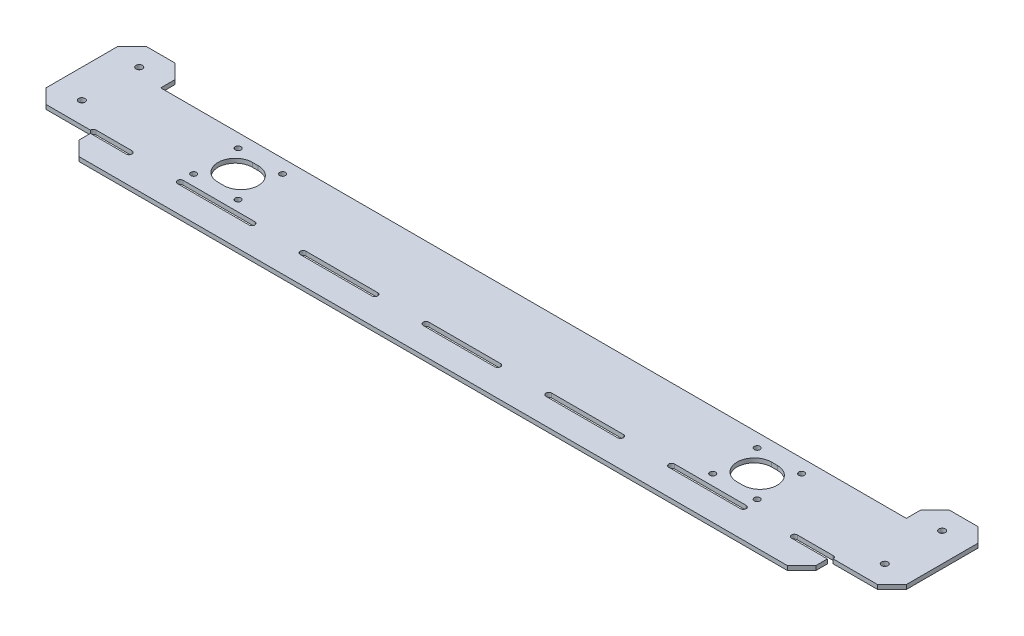
from build123d import *

# Parameters (mm, degrees)
BOSS_EXTRUDE1_DEPTH = 3
CHAMFER1_SIZE       = 10
SKETCH2_R           = 2.25
CUT_EXTRUDE1_DEPTH  = 3
SKETCH3_R           = 2
CUT_EXTRUDE2_DEPTH  = 3


with BuildPart() as part:
    # Sketch1 → Boss-Extrude1 (new body)
    with BuildSketch(Plane(origin=(0, 0, 0), x_dir=(1, 0, 0), z_dir=(0, 1, 0))):
        with BuildLine():
            Line((0, 0), (40, 0))
            Line((40, 0), (41, 0))
            ThreePointArc((41, 0), (41.585786438, 1.414213562), (43, 2))
            Line((43, 2), (68, 2))
            ThreePointArc((68, 2), (70, 0), (68, -2))
            Line((68, -2), (43, -2))
            Line((43, -2), (43, -20))
            Line((43, -20), (300, -20))
            Line((300, -20), (300, -2))
            Line((300, -2), (275, -2))
            ThreePointArc((275, -2), (273, 0), (275, 2))
            Line((275, 2), (300, 2))
            Line((300, 2), (300, 50))
            Line((300, 50), (40, 50))
            Line((40, 50), (40, 70))
            Line((40, 70), (0, 70))
            Line((0, 70), (0, 0))
        make_face()
        with BuildLine():
            Line((103.666666667, 2), (153.666666667, 2))
            ThreePointArc((153.666666667, 2), (155.666666667, 0), (153.666666667, -2))
            Line((153.666666667, -2), (103.666666667, -2))
            ThreePointArc((103.666666667, -2), (101.666666667, 0), (103.666666667, 2))
        make_face(mode=Mode.SUBTRACT)
        with BuildLine():
            Line((189.333333333, 2), (239.333333333, 2))
            ThreePointArc((239.333333333, 2), (241.333333333, 0), (239.333333333, -2))
            Line((239.333333333, -2), (189.333333333, -2))
            ThreePointArc((189.333333333, -2), (187.333333333, 0), (189.333333333, 2))
        make_face(mode=Mode.SUBTRACT)
    extrude(amount=BOSS_EXTRUDE1_DEPTH)

    # Chamfer1
    chamfer1_edges = [part.edges().sort_by_distance(p)[0] for p in [
        (40, 1.5, -70),
        (0, 1.5, -70),
        (0, 1.5, 0),
        (43, 1.5, 20),
    ]]
    chamfer(chamfer1_edges, length=CHAMFER1_SIZE)

    # Sketch2 → Cut-Extrude1 (cut)
    with BuildSketch(Plane(origin=(0, 3, 0), x_dir=(1, 0, 0), z_dir=(0, 1, 0))):
        with Locations((20, 55)):
            Circle(SKETCH2_R)
        with Locations((20, 15)):
            Circle(SKETCH2_R)
    extrude(amount=-CUT_EXTRUDE1_DEPTH, mode=Mode.SUBTRACT)

    # Sketch3 → Cut-Extrude2 (cut)
    with BuildSketch(Plane(origin=(0, 3, 0), x_dir=(1, 0, 0), z_dir=(0, 1, 0))):
        with Locations((103.5, 40.5)):
            Circle(SKETCH3_R)
        with Locations((134.5, 40.5)):
            Circle(SKETCH3_R)
        with Locations((134.5, 9.5)):
            Circle(SKETCH3_R)
        with Locations((103.5, 9.5)):
            Circle(SKETCH3_R)
        with BuildLine():
            Line((117, 37), (121, 37))
            ThreePointArc((121, 37), (133, 25), (121, 13))
            Line((121, 13), (117, 13))
            ThreePointArc((117, 13), (105, 25), (117, 37))
        make_face()
    extrude(amount=-CUT_EXTRUDE2_DEPTH, mode=Mode.SUBTRACT)

    # Mirror3: part across plane


with BuildPart() as part_1:
    add(part.part)
    add(part.part.mirror(Plane(origin=(300, 0, 0), x_dir=(0, 0, 1), z_dir=(1, 0, 0))))


solid = part_1.part
